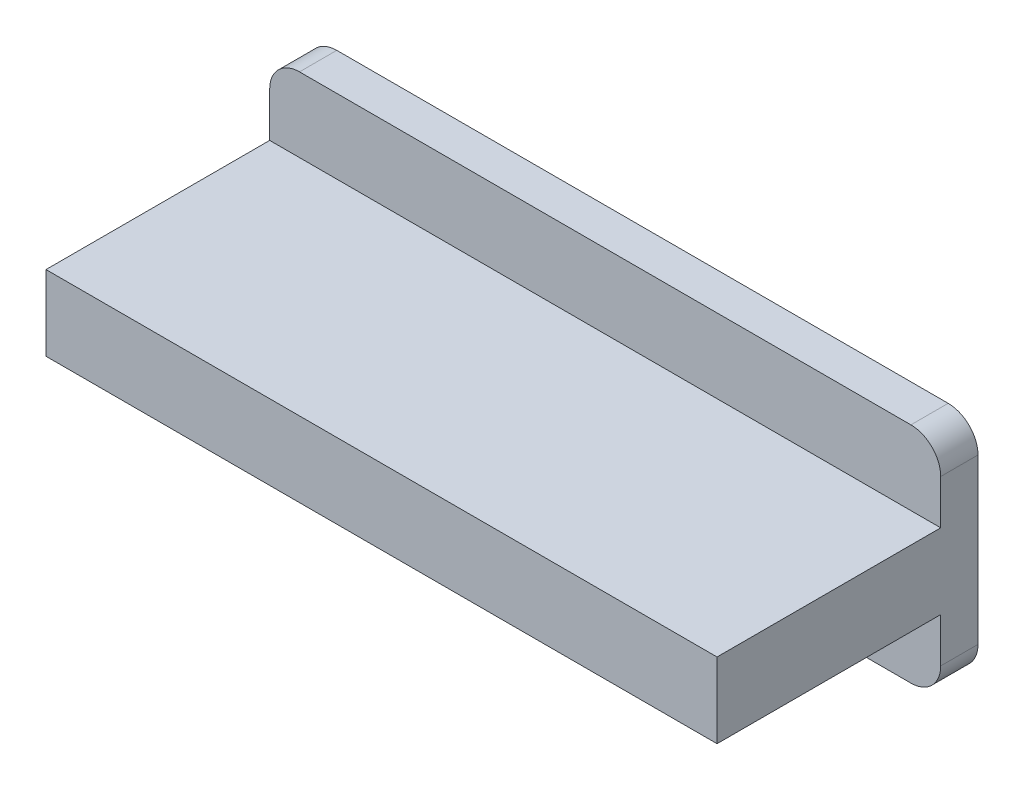
from build123d import *

# Parameters (mm, degrees)
SKETCH1_W           = 57.15
SKETCH1_H           = 19.05
BOSS_EXTRUDE1_DEPTH = 3.175
SKETCH2_W           = 57.15
SKETCH2_H           = 6.398717948
BOSS_EXTRUDE2_DEPTH = 19.05
FILLET1_R           = 2.54


with BuildPart() as part:
    # Sketch1 → Boss-Extrude1 (new body)
    with BuildSketch(Plane.XY):
        Rectangle(SKETCH1_W, SKETCH1_H)
    extrude(amount=BOSS_EXTRUDE1_DEPTH)

    # Sketch2 → Boss-Extrude2 (add)
    with BuildSketch(Plane.XY.offset(3.175)):
        Rectangle(SKETCH2_W, SKETCH2_H)
    extrude(amount=BOSS_EXTRUDE2_DEPTH)

    # Fillet1
    fillet1_edges = [part.edges().sort_by_distance(p)[0] for p in [
        (-28.575, -9.525, 1.5875),
        (-28.575, 9.525, 1.5875),
        (28.575, 9.525, 1.5875),
        (28.575, -9.525, 1.5875),
    ]]
    fillet(fillet1_edges, radius=FILLET1_R)


solid = part.part
